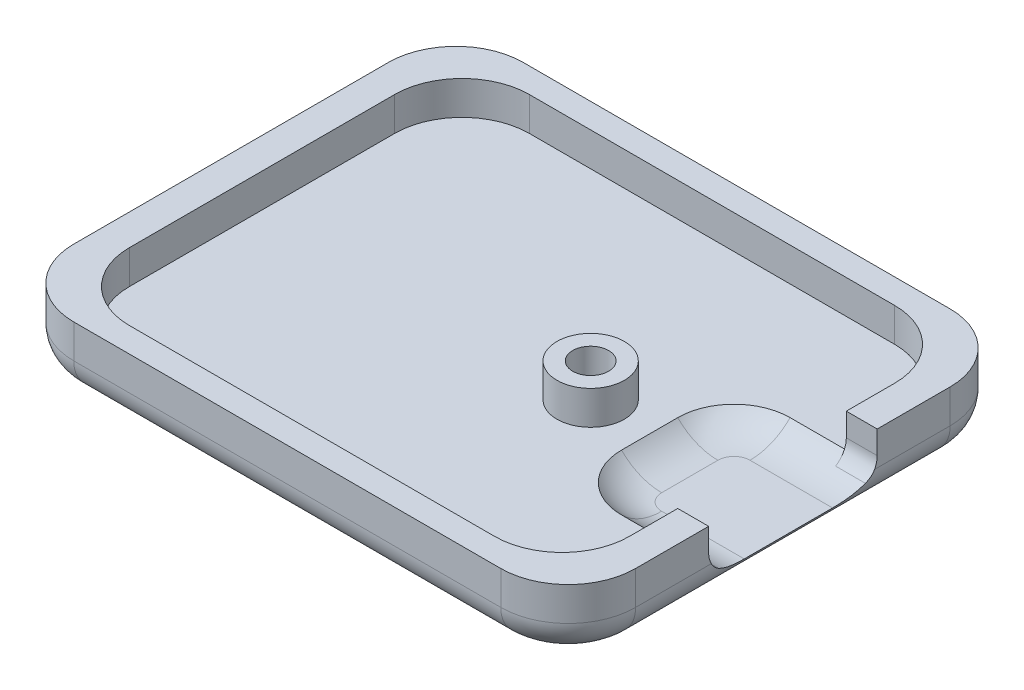
from build123d import *

# Parameters (mm, degrees)
SKETCH1_W           = 50
SKETCH1_H           = 40
SKETCH1_W_2         = 44.5
SKETCH1_H_2         = 35.6
BOSS_EXTRUDE1_DEPTH = 6
SKETCH2_W           = 44.5
SKETCH2_H           = 35.6
BOSS_EXTRUDE2_DEPTH = 3
SKETCH3_R           = 3
BOSS_EXTRUDE3_DEPTH = 3
SKETCH4_R           = 1.6
CUT_EXTRUDE1_DEPTH  = 6
FILLET1_R           = 6
CHAMFER1_SIZE       = 1.5
FILLET2_R           = 3
CUT_EXTRUDE2_START  = -1.5
SKETCH5_W           = 12.75
SKETCH5_H           = 15
CUT_EXTRUDE2_DEPTH  = 4.5
FILLET3_R           = 5
FILLET4_R           = 5
FILLET5_R           = 2


with BuildPart() as part:
    # Sketch1 → Boss-Extrude1 (new body)
    with BuildSketch(Plane(origin=(0, 0, 0), x_dir=(1, 0, 0), z_dir=(0, 1, 0))):
        Rectangle(SKETCH1_W, SKETCH1_H)
        Rectangle(SKETCH1_W_2, SKETCH1_H_2, mode=Mode.SUBTRACT)
    extrude(amount=BOSS_EXTRUDE1_DEPTH)

    # Sketch2 → Boss-Extrude2 (add)
    with BuildSketch(Plane(origin=(0, 0, 0), x_dir=(-1, 0, 0), z_dir=(0, -1, 0))):
        Rectangle(SKETCH2_W, SKETCH2_H)
    extrude(amount=-BOSS_EXTRUDE2_DEPTH)

    # Sketch3 → Boss-Extrude3 (add)
    with BuildSketch(Plane(origin=(0, 3, 0), x_dir=(1, 0, 0), z_dir=(0, 1, 0))):
        with Locations(Location((7, 0, 0), (0, 0, 270))):
            Circle(SKETCH3_R)
    extrude(amount=BOSS_EXTRUDE3_DEPTH)

    # Sketch4 → Cut-Extrude1 (cut)
    with BuildSketch(Plane(origin=(0, 6, 0), x_dir=(1, 0, 0), z_dir=(0, 1, 0))):
        with Locations(Location((7, 0, 0), (0, 0, 270))):
            Circle(SKETCH4_R)
    extrude(amount=-CUT_EXTRUDE1_DEPTH, mode=Mode.SUBTRACT)

    # Fillet1
    fillet1_edges = [part.edges().sort_by_distance(p)[0] for p in [
        (22.25, 4.5, 17.8),
        (22.25, 4.5, -17.8),
        (-22.25, 4.5, -17.8),
        (-22.25, 4.5, 17.8),
        (-25, 3, -20),
        (25, 3, -20),
        (25, 3, 20),
        (-25, 3, 20),
    ]]
    fillet(fillet1_edges, radius=FILLET1_R)

    # Chamfer1
    chamfer1_edges = [part.edges().sort_by_distance(p)[0] for p in [
        (7, 0, -1.6),
    ]]
    chamfer(chamfer1_edges, length=CHAMFER1_SIZE)

    # Fillet2
    fillet2_edges = [part.edges().sort_by_distance(p)[0] for p in [
        (-25, 0, 0),
        (0, 0, -20),
        (25, 0, 0),
        (0, 0, 20),
        (23.242640687, 0, -18.242640687),
        (23.242640687, 0, 18.242640687),
        (-23.242640687, 0, 18.242640687),
        (-23.242640687, 0, -18.242640687),
    ]]
    fillet(fillet2_edges, radius=FILLET2_R)

    # Sketch5 → Cut-Extrude2 (cut)
    with BuildSketch(Plane(origin=(0, 3, 0), x_dir=(1, 0, 0), z_dir=(0, 1, 0)).offset(CUT_EXTRUDE2_START)):
        with Locations((18.625, 0)):
            Rectangle(SKETCH5_W, SKETCH5_H)
    extrude(amount=CUT_EXTRUDE2_DEPTH, mode=Mode.SUBTRACT)

    # Fillet3
    fillet3_edges = [part.edges().sort_by_distance(p)[0] for p in [
        (12.25, 2.25, -7.5),
        (12.25, 2.25, 7.5),
    ]]
    fillet(fillet3_edges, radius=FILLET3_R)

    # Fillet4
    # the kernel refuses this fillet: 5 mm, written as the material it adds along each edge
    with BuildSketch(Plane(origin=(33.524861747, 1.5, 7.5), x_dir=(0, 1, 0), z_dir=(-1, 0, 0))) as fillet4_piece_1_section:
        with BuildLine():
            CenterArc((5, 3.570714214), FILLET4_R, 180, 45.572995999)
            Line((0, 3.570714214), (-0.1, 3.570714214))
            Line((-0.1, 3.570714214), (-0.1, 0))
            Line((-0.1, 0), (0, -0.1))
            ThreePointArc((0, -0.1), (0.75, -0.1), (1.43, -0.071414284))
            Line((1.43, -0.071414284), (1.5, 0))
        make_face()
    fillet4_piece_1 = extrude(amount=16.274861747, mode=Mode.PRIVATE)
    fillet4_piece_1 = fillet4_piece_1 & Plane(origin=(22, 3, 6.572740675), x_dir=(0, -1, 0), z_dir=(0, 0, 1)) * Cylinder(3, 47, mode=Mode.PRIVATE)
    fillet4_piece_1 = split(fillet4_piece_1, bisect_by=Plane(origin=(22.25, 1.89059937, 6.572740675), z_dir=(1, 0, 0)), keep=Keep.TOP, mode=Mode.PRIVATE)
    add(fillet4_piece_1)
    with BuildSketch(Plane(origin=(33.524861747, 1.5, 7.5), x_dir=(0, 1, 0), z_dir=(-1, 0, 0))) as fillet4_piece_2_section:
        with BuildLine():
            CenterArc((5, 3.570714214), FILLET4_R, 180, 45.572995999)
            Line((0, 3.570714214), (-0.1, 3.570714214))
            Line((-0.1, 3.570714214), (-0.1, 0))
            Line((-0.1, 0), (0, -0.1))
            ThreePointArc((0, -0.1), (0.75, -0.1), (1.43, -0.071414284))
            Line((1.43, -0.071414284), (1.5, 0))
        make_face()
    fillet4_piece_2 = extrude(amount=16.274861747, mode=Mode.PRIVATE)
    fillet4_piece_2 = fillet4_piece_2 & Plane(origin=(22, 3, 6.568122806), x_dir=(0, -1, 0), z_dir=(0, 0, 1)) * Cylinder(3, 47, mode=Mode.PRIVATE)
    fillet4_piece_2 = split(fillet4_piece_2, bisect_by=Plane(origin=(22.25, 1.887314872, 6.568122806), z_dir=(-1, 0, 0)), keep=Keep.TOP, mode=Mode.PRIVATE)
    add(fillet4_piece_2)
    with BuildSketch(Plane(origin=(33.524861747, 1.5, 7.5), x_dir=(0, 1, 0), z_dir=(-1, 0, 0))) as fillet4_piece_3_section:
        with BuildLine():
            CenterArc((5, 3.570714214), FILLET4_R, 180, 45.572995999)
            Line((0, 3.570714214), (-0.1, 3.570714214))
            Line((-0.1, 3.570714214), (-0.1, 0))
            Line((-0.1, 0), (0, -0.1))
            ThreePointArc((0, -0.1), (0.75, -0.1), (1.43, -0.071414284))
            Line((1.43, -0.071414284), (1.5, 0))
        make_face()
    fillet4_piece_3 = extrude(amount=16.274861747, mode=Mode.PRIVATE)
    fillet4_piece_3 = fillet4_piece_3 - Plane(origin=(22, 3, 6.51033781), x_dir=(0, -1, 0), z_dir=(0, 0, 1)) * Cylinder(3, 47, mode=Mode.PRIVATE)
    fillet4_piece_3 = split(fillet4_piece_3, bisect_by=Plane(origin=(22.25, 1.84623237, 6.51033781), z_dir=(-1, 0, 0)), keep=Keep.TOP, mode=Mode.PRIVATE)
    add(fillet4_piece_3)
    with BuildSketch(Plane(origin=(17.25, 1.5, 2.5), x_dir=(0, 0, 1), z_dir=(1, 0, 0))) as fillet4_piece_4:
        with BuildLine():
            CenterArc((1.429285786, -5), FILLET4_R, 44.427004001, 45.572995999)
            Line((5, -1.5), (5.071414284, -1.43))
            ThreePointArc((5.071414284, -1.43), (5.1, -0.75), (5.1, 0))
            Line((5.1, 0), (5, 0.1))
            Line((5, 0.1), (1.429285786, 0.1))
            Line((1.429285786, 0.1), (1.429285786, 0))
        make_face()
    revolve(axis=Axis((17.25, 1.5, 2.5), (0, -1, 0)), revolution_arc=90)
    with BuildSketch(Plane(origin=(12.25, 1.5, 2.5), x_dir=(1, 0, 0), z_dir=(0, 0, -1))) as fillet4_piece_5:
        with BuildLine():
            CenterArc((3.570714214, -5), FILLET4_R, 90, 45.572995999)
            Line((0, -1.5), (-0.071414284, -1.43))
            ThreePointArc((-0.071414284, -1.43), (-0.1, -0.75), (-0.1, 0))
            Line((-0.1, 0), (0, 0.1))
            Line((0, 0.1), (3.570714214, 0.1))
            Line((3.570714214, 0.1), (3.570714214, 0))
        make_face()
    extrude(amount=5)
    with BuildSketch(Plane(origin=(17.25, 1.5, -2.5), x_dir=(0, 0, -1), z_dir=(1, 0, 0))) as fillet4_piece_6:
        with BuildLine():
            CenterArc((1.429285786, 5), FILLET4_R, 270, 45.572995999)
            Line((5, 1.5), (5.071414284, 1.43))
            ThreePointArc((5.071414284, 1.43), (5.1, 0.75), (5.1, 0))
            Line((5.1, 0), (5, -0.1))
            Line((5, -0.1), (1.429285786, -0.1))
            Line((1.429285786, -0.1), (1.429285786, 0))
        make_face()
    revolve(axis=Axis((17.25, 1.5, -2.5), (0, 1, 0)), revolution_arc=90)
    with BuildSketch(Plane(origin=(17.25, 1.5, -7.5), x_dir=(0, 0, 1), z_dir=(1, 0, 0))) as fillet4_piece_7_section:
        with BuildLine():
            CenterArc((3.570714214, -5), FILLET4_R, 90, 45.572995999)
            Line((0, -1.5), (-0.071414284, -1.43))
            ThreePointArc((-0.071414284, -1.43), (-0.1, -0.75), (-0.1, 0))
            Line((-0.1, 0), (0, 0.1))
            Line((0, 0.1), (3.570714214, 0.1))
            Line((3.570714214, 0.1), (3.570714214, 0))
        make_face()
    fillet4_piece_7 = extrude(amount=16.274861747, mode=Mode.PRIVATE)
    fillet4_piece_7 = fillet4_piece_7 - Plane(origin=(22, 3, -6.510337786), x_dir=(0, -1, 0), z_dir=(0, 0, 1)) * Cylinder(3, 47, mode=Mode.PRIVATE)
    fillet4_piece_7 = split(fillet4_piece_7, bisect_by=Plane(origin=(22.25, 1.846232349, -6.510337786), z_dir=(-1, 0, 0)), keep=Keep.TOP, mode=Mode.PRIVATE)
    add(fillet4_piece_7)
    with BuildSketch(Plane(origin=(17.25, 1.5, -7.5), x_dir=(0, 0, 1), z_dir=(1, 0, 0))) as fillet4_piece_8_section:
        with BuildLine():
            CenterArc((3.570714214, -5), FILLET4_R, 90, 45.572995999)
            Line((0, -1.5), (-0.071414284, -1.43))
            ThreePointArc((-0.071414284, -1.43), (-0.1, -0.75), (-0.1, 0))
            Line((-0.1, 0), (0, 0.1))
            Line((0, 0.1), (3.570714214, 0.1))
            Line((3.570714214, 0.1), (3.570714214, 0))
        make_face()
    fillet4_piece_8 = extrude(amount=16.274861747, mode=Mode.PRIVATE)
    fillet4_piece_8 = fillet4_piece_8 & Plane(origin=(22, 3, -6.568122817), x_dir=(0, -1, 0), z_dir=(0, 0, 1)) * Cylinder(3, 47, mode=Mode.PRIVATE)
    fillet4_piece_8 = split(fillet4_piece_8, bisect_by=Plane(origin=(22.25, 1.887314882, -6.568122817), z_dir=(-1, 0, 0)), keep=Keep.TOP, mode=Mode.PRIVATE)
    add(fillet4_piece_8)
    with BuildSketch(Plane(origin=(17.25, 1.5, -7.5), x_dir=(0, 0, 1), z_dir=(1, 0, 0))) as fillet4_piece_9_section:
        with BuildLine():
            CenterArc((3.570714214, -5), FILLET4_R, 90, 45.572995999)
            Line((0, -1.5), (-0.071414284, -1.43))
            ThreePointArc((-0.071414284, -1.43), (-0.1, -0.75), (-0.1, 0))
            Line((-0.1, 0), (0, 0.1))
            Line((0, 0.1), (3.570714214, 0.1))
            Line((3.570714214, 0.1), (3.570714214, 0))
        make_face()
    fillet4_piece_9 = extrude(amount=16.274861747, mode=Mode.PRIVATE)
    fillet4_piece_9 = fillet4_piece_9 & Plane(origin=(22, 3, -6.572740691), x_dir=(0, -1, 0), z_dir=(0, 0, 1)) * Cylinder(3, 47, mode=Mode.PRIVATE)
    fillet4_piece_9 = split(fillet4_piece_9, bisect_by=Plane(origin=(22.25, 1.890599382, -6.572740691), z_dir=(1, 0, 0)), keep=Keep.TOP, mode=Mode.PRIVATE)
    add(fillet4_piece_9)

    # Fillet5
    # the kernel refuses this fillet: 2 mm, written as the material it adds along each edge
    with BuildSketch(Plane(origin=(25, 3, 7.5), x_dir=(0, 1, 0), z_dir=(-1, 0, 0))) as fillet5_piece_1_section:
        with BuildLine():
            CenterArc((0.944054606, 2), FILLET5_R, 211.572120622, 58.427879378)
            ThreePointArc((-0.75990899, 0.95285719), (-0.409095943, 0.453188126), (0, 0))
            Line((0, 0), (0.944054606, 0))
        make_face()
    fillet5_piece_1 = extrude(amount=2.75, mode=Mode.PRIVATE)
    fillet5_piece_1 = split(fillet5_piece_1, bisect_by=Plane(origin=(24.978634631, 3, 7.467226541), z_dir=(0, 1, 0)), keep=Keep.TOP, mode=Mode.PRIVATE)
    add(fillet5_piece_1)
    with BuildSketch(Plane(origin=(28.046923139, 3, 7.5), x_dir=(0, 1, 0), z_dir=(-1, 0, 0))) as fillet5_piece_2_section:
        with BuildLine():
            CenterArc((0.944054606, 2), FILLET5_R, 211.572120622, 58.427879378)
            ThreePointArc((-0.75990899, 0.95285719), (-0.409095943, 0.453188126), (0, 0))
            Line((0, 0), (0.944054606, 0))
        make_face()
    fillet5_piece_2 = extrude(amount=5.796923139, mode=Mode.PRIVATE)
    fillet5_piece_2 = fillet5_piece_2 & Plane(origin=(22, 3, 7.194507962), x_dir=(0, -1, 0), z_dir=(0, 0, 1)) * Cylinder(3, 16, mode=Mode.PRIVATE)
    add(fillet5_piece_2)
    with BuildSketch(Plane(origin=(22.25, 3, -7.5), x_dir=(0, -0.6235052176328177, 0.7818191885497904), z_dir=(1, 0, 0))) as fillet5_piece_3_section:
        with BuildLine():
            CenterArc((0.975015405, -1.985090441), FILLET5_R, 82.999562312, 58.427879378)
            Line((-0.588622973, -0.738080006), (0, 0))
            ThreePointArc((0, 0), (0.609384628, 0.037273897), (1.218769256, 0))
        make_face()
    fillet5_piece_3 = extrude(amount=5.796923139, mode=Mode.PRIVATE)
    fillet5_piece_3 = fillet5_piece_3 & Plane(origin=(22, 3, -7.194507962), x_dir=(0, -1, 0), z_dir=(0, 0, 1)) * Cylinder(3, 17, mode=Mode.PRIVATE)
    add(fillet5_piece_3)
    with BuildSketch(Plane(origin=(22.25, 3, -7.5), x_dir=(0, -0.6235052176328177, 0.7818191885497904), z_dir=(1, 0, 0))) as fillet5_piece_4_section:
        with BuildLine():
            CenterArc((0.975015405, -1.985090441), FILLET5_R, 82.999562312, 58.427879378)
            Line((-0.588622973, -0.738080006), (0, 0))
            ThreePointArc((0, 0), (0.609384628, 0.037273897), (1.218769256, 0))
        make_face()
    fillet5_piece_4 = extrude(amount=2.75, mode=Mode.PRIVATE)
    fillet5_piece_4 = split(fillet5_piece_4, bisect_by=Plane(origin=(24.978634649, 3, -7.467226583), z_dir=(0, 1, 0)), keep=Keep.TOP, mode=Mode.PRIVATE)
    add(fillet5_piece_4)


solid = part.part
